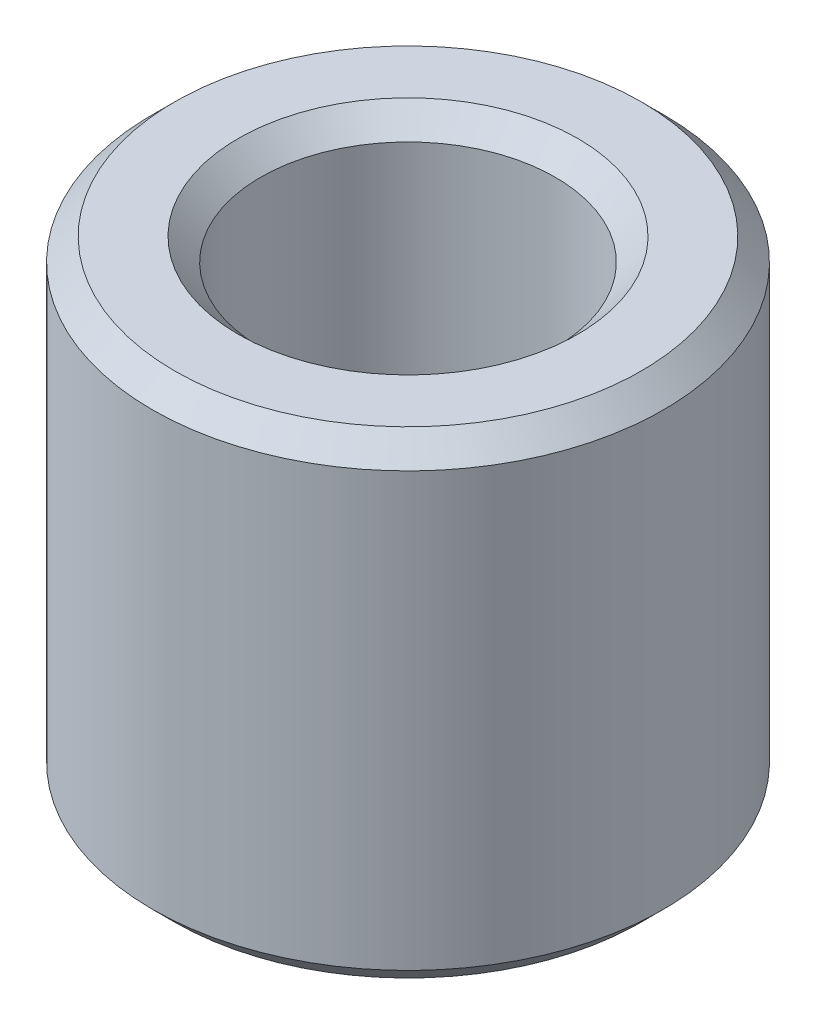
from build123d import *

# Parameters (mm, degrees)
SKETCH1_R           = 37.5
BOSS_EXTRUDE1_DEPTH = 70.033583409
SKETCH2_R           = 21.617277524
CUT_EXTRUDE1_DEPTH  = 88.847611266
CHAMFER1_SIZE       = 3.284147054


with BuildPart() as part:
    # Sketch1 → Boss-Extrude1 (new body)
    with BuildSketch(Plane(origin=(0, 0, 0), x_dir=(1, 0, 0), z_dir=(0, 1, 0))):
        Circle(SKETCH1_R)
    extrude(amount=BOSS_EXTRUDE1_DEPTH)

    # Sketch2 → Cut-Extrude1 (cut, through all)
    with BuildSketch(Plane(origin=(0, 0, 0), x_dir=(1, 0, 0), z_dir=(0, 1, 0))):
        Circle(SKETCH2_R)
    extrude(amount=CUT_EXTRUDE1_DEPTH, mode=Mode.SUBTRACT)

    # Chamfer1
    chamfer1_edges = [part.edges().sort_by_distance(p)[0] for p in [
        (-21.617277524, 70.033583409, 0),
        (-21.617277524, 0, 0),
        (-37.5, 0, 0),
        (-37.5, 70.033583409, 0),
    ]]
    chamfer(chamfer1_edges, length=CHAMFER1_SIZE)


solid = part.part
